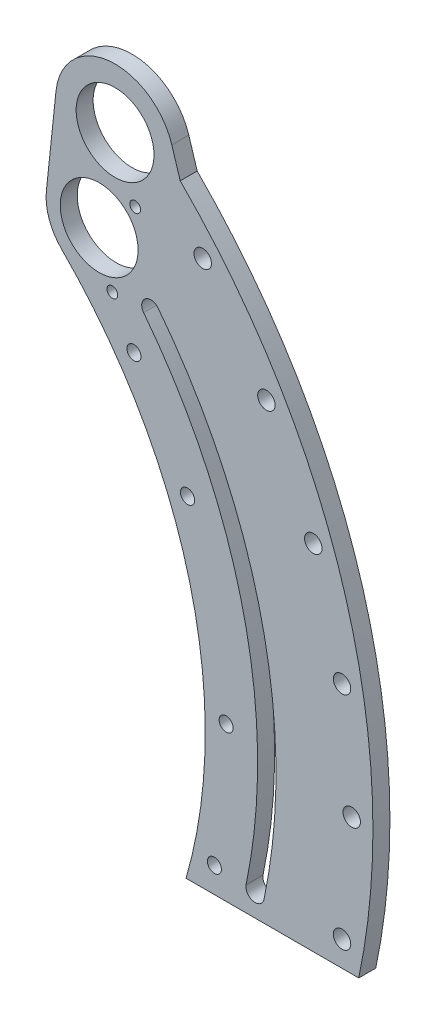
from build123d import *

# Parameters (mm, degrees)
SKETCH1_R           = 2.6289
SKETCH1_R_2         = 3.2639
SKETCH1_R_3         = 2.667
BOSS_EXTRUDE1_DEPTH = 6.35
SKETCH3_R           = 14.5542
BOSS_EXTRUDE2_DEPTH = 6.35
SKETCH4_R           = 14.5542
SKETCH4_R_2         = 2.0193
CUT_EXTRUDE1_DEPTH  = 317.951798078


with BuildPart() as part:
    # Sketch1 → Boss-Extrude1 (new body)
    with BuildSketch(Plane.XY):
        with BuildLine():
            ThreePointArc((183.35625, 0), (181.552952325, -25.652288715), (176.178529946, -50.8))
            Line((176.178529946, -50.8), (240.761529124, -50.8))
            ThreePointArc((240.761529124, -50.8), (235.877364624, 70.061564101), (173.992462346, 173.992462346))
            Line((173.992462346, 173.992462346), (129.652447748, 129.652447748))
            ThreePointArc((129.652447748, 129.652447748), (169.399086533, 70.167399096), (183.35625, 0))
        make_face()
        with Locations((186.787775735, -41.275)):
            Circle(SKETCH1_R, mode=Mode.SUBTRACT)
        with BuildLine():
            ThreePointArc((198.61336608, -41.711026485), (201.859935486, -20.967721902), (202.946, 0))
            ThreePointArc((202.946, 0), (191.993196693, 65.769988136), (160.317011605, 124.440888401))
            ThreePointArc((160.317011605, 124.440888401), (160.923178893, 129.252192093), (165.734482585, 128.646024805))
            ThreePointArc((165.734482585, 128.646024805), (198.481076932, 67.99250338), (209.804, 0))
            ThreePointArc((209.804, 0), (208.692287116, -21.569601625), (205.368929989, -42.910616532))
            ThreePointArc((205.368929989, -42.910616532), (201.391341659, -45.688667392), (198.61336608, -41.711026485))
        make_face(mode=Mode.SUBTRACT)
        with Locations((234.507346186, -41.349972307)):
            Circle(SKETCH1_R_2, mode=Mode.SUBTRACT)
        with Locations((238.125, 0)):
            Circle(SKETCH1_R_2, mode=Mode.SUBTRACT)
        with Locations((191.177219016, 6.676055597)):
            Circle(SKETCH1_R, mode=Mode.SUBTRACT)
        with Locations((234.507346186, 41.349972307)):
            Circle(SKETCH1_R_2, mode=Mode.SUBTRACT)
        with Locations((156.698666372, 109.721587421)):
            Circle(SKETCH1_R, mode=Mode.SUBTRACT)
        with Locations((176.732380322, 73.20494884)):
            Circle(SKETCH1_R_3, mode=Mode.SUBTRACT)
        with Locations((182.414333018, 153.063799557)):
            Circle(SKETCH1_R_2, mode=Mode.SUBTRACT)
        with Locations((223.764305325, 81.443546629)):
            Circle(SKETCH1_R_2, mode=Mode.SUBTRACT)
        with Locations((206.222299276, 119.0625)):
            Circle(SKETCH1_R_2, mode=Mode.SUBTRACT)
    extrude(amount=BOSS_EXTRUDE1_DEPTH)

    # Sketch3 → Boss-Extrude2 (add)
    with BuildSketch(Plane.XY.offset(6.35)):
        with BuildLine():
            Line((129.652447748, 129.652447748), (161.644610179, 161.644610179))
            Line((161.644610179, 161.644610179), (173.992462346, 173.992462346))
            Line((173.992462346, 173.992462346), (170.859248883, 184.058470698))
            ThreePointArc((170.859248883, 184.058470698), (147.455873476, 199.570723305), (127.535972557, 179.783214398))
            Line((127.535972557, 179.783214398), (123.949703837, 145.76450741))
            ThreePointArc((123.949703837, 145.76450741), (124.977520127, 137.063043588), (129.652447748, 129.652447748))
        make_face()
        with Locations((149.638493949, 177.453155788)):
            Circle(SKETCH3_R, mode=Mode.SUBTRACT)
    extrude(amount=-BOSS_EXTRUDE2_DEPTH)

    # Sketch4 → Cut-Extrude1 (cut, through all)
    with BuildSketch(Plane.XY.offset(6.35)):
        with Locations((143.684097937, 143.684097937)):
            Circle(SKETCH4_R)
        with Locations((157.154482119, 157.154482119)):
            Circle(SKETCH4_R_2)
        with Locations((148.614600746, 125.283210946)):
            Circle(SKETCH4_R_2)
    extrude(amount=-CUT_EXTRUDE1_DEPTH, mode=Mode.SUBTRACT)


solid = part.part
